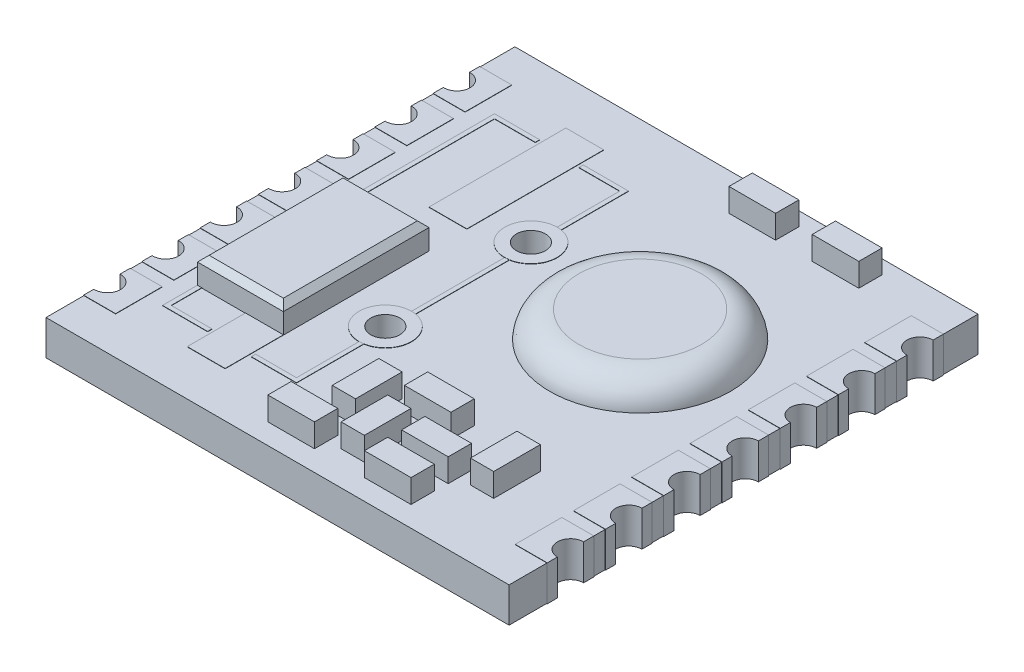
from build123d import *

# Parameters (mm, degrees)
SKIZZE1_W                       = 15.9
SKIZZE1_H                       = 1.2
LINEAR_AUSTRAGEN1_DEPTH         = 16.1
SKIZZE4_W                       = 1.6
SKIZZE4_H                       = 1.2
LINEAR_AUSTRAGEN2_DEPTH         = 0.01
SKIZZE3_W                       = 1.6
SKIZZE3_H                       = 1.2
LINEAR_AUSTRAGEN3_DEPTH         = 0.01
SKIZZE5_W                       = 1.1
SKIZZE5_H                       = 1.6
LINEAR_AUSTRAGEN4_DEPTH         = 0.01
SKIZZE6_W                       = 1.1
SKIZZE6_H                       = 1.6
LINEAR_AUSTRAGEN5_DEPTH         = 0.01
SKIZZE7_R                       = 0.45
SCHNITT_LINEAR_AUSTRAGEN2_DEPTH = 2
SKIZZE8_R                       = 3.1
LINEAR_AUSTRAGEN6_DEPTH         = 0.9
VERRUNDUNG1_R                   = 1
LINEAR_AUSTRAGEN7_DEPTH         = 0.01
SKIZZE10_R                      = 0.9
LINEAR_AUSTRAGEN9_DEPTH         = 0.011
SKIZZE11_R                      = 0.5
SCHNITT_LINEAR_AUSTRAGEN3_DEPTH = 2
SKIZZE12_W                      = 1.3
SKIZZE12_H                      = 4.7
LINEAR_AUSTRAGEN10_DEPTH        = 0.01
SKIZZE13_W                      = 2.95
SKIZZE13_H                      = 5
LINEAR_AUSTRAGEN11_DEPTH        = 0.9
FASE1_SIZE                      = 0.2
SKIZZE14_W                      = 1.6
SKIZZE14_H                      = 0.8
SKIZZE14_W_2                    = 0.8
SKIZZE14_H_2                    = 1.6
LINEAR_AUSTRAGEN12_DEPTH        = 0.8


with BuildPart() as part:
    # Skizze1 → Linear austragen1 (new body)
    with BuildSketch(Plane.XY):
        with Locations((7.95, 0.6)):
            Rectangle(SKIZZE1_W, SKIZZE1_H)
    extrude(amount=LINEAR_AUSTRAGEN1_DEPTH)

    # Skizze4 → Linear austragen2 (add)
    with BuildSketch(Plane.ZY):
        with Locations((14, 0.6)):
            Rectangle(SKIZZE4_W, SKIZZE4_H)
        with Locations((12, 0.6)):
            Rectangle(SKIZZE4_W, SKIZZE4_H)
        with Locations((10, 0.6)):
            Rectangle(SKIZZE4_W, SKIZZE4_H)
        with Locations((8, 0.6)):
            Rectangle(SKIZZE4_W, SKIZZE4_H)
        with Locations((6, 0.6)):
            Rectangle(SKIZZE4_W, SKIZZE4_H)
        with Locations((4, 0.6)):
            Rectangle(SKIZZE4_W, SKIZZE4_H)
        with Locations((2, 0.6)):
            Rectangle(SKIZZE4_W, SKIZZE4_H)
    extrude(amount=LINEAR_AUSTRAGEN2_DEPTH)

    # Skizze3 → Linear austragen3 (add)
    with BuildSketch(Plane(origin=(15.9, 0, 0), x_dir=(0, 0, -1), z_dir=(1, 0, 0))):
        with Locations((-14, 0.6)):
            Rectangle(SKIZZE3_W, SKIZZE3_H)
        with Locations((-12, 0.6)):
            Rectangle(SKIZZE3_W, SKIZZE3_H)
        with Locations((-10, 0.6)):
            Rectangle(SKIZZE3_W, SKIZZE3_H)
        with Locations((-8, 0.6)):
            Rectangle(SKIZZE3_W, SKIZZE3_H)
        with Locations((-6, 0.6)):
            Rectangle(SKIZZE3_W, SKIZZE3_H)
        with Locations((-4, 0.6)):
            Rectangle(SKIZZE3_W, SKIZZE3_H)
        with Locations((-2, 0.6)):
            Rectangle(SKIZZE3_W, SKIZZE3_H)
    extrude(amount=LINEAR_AUSTRAGEN3_DEPTH)

    # Skizze5 → Linear austragen4 (add)
    with BuildSketch(Plane(origin=(0, 1.2, 0), x_dir=(-1, 0, 0), z_dir=(0, 1, 0))):
        with Locations((-15.36, 2)):
            Rectangle(SKIZZE5_W, SKIZZE5_H)
        with Locations((-15.36, 4)):
            Rectangle(SKIZZE5_W, SKIZZE5_H)
        with Locations((-15.36, 8)):
            Rectangle(SKIZZE5_W, SKIZZE5_H)
        with Locations((-15.36, 10)):
            Rectangle(SKIZZE5_W, SKIZZE5_H)
        with Locations((-15.36, 12)):
            Rectangle(SKIZZE5_W, SKIZZE5_H)
        with Locations((-15.36, 14)):
            Rectangle(SKIZZE5_W, SKIZZE5_H)
        with Locations((-15.36, 6)):
            Rectangle(SKIZZE5_W, SKIZZE5_H)
        with Locations((-0.54, 2)):
            Rectangle(SKIZZE5_W, SKIZZE5_H)
        with Locations((-0.54, 4)):
            Rectangle(SKIZZE5_W, SKIZZE5_H)
        with Locations((-0.54, 6)):
            Rectangle(SKIZZE5_W, SKIZZE5_H)
        with Locations((-0.54, 8)):
            Rectangle(SKIZZE5_W, SKIZZE5_H)
        with Locations((-0.54, 10)):
            Rectangle(SKIZZE5_W, SKIZZE5_H)
        with Locations((-0.54, 12)):
            Rectangle(SKIZZE5_W, SKIZZE5_H)
        with Locations((-0.54, 14)):
            Rectangle(SKIZZE5_W, SKIZZE5_H)
    extrude(amount=LINEAR_AUSTRAGEN4_DEPTH)

    # Skizze6 → Linear austragen5 (add)
    with BuildSketch(Plane.XZ):
        with Locations((15.36, 14)):
            Rectangle(SKIZZE6_W, SKIZZE6_H)
        with Locations((15.36, 12)):
            Rectangle(SKIZZE6_W, SKIZZE6_H)
        with Locations((15.36, 10)):
            Rectangle(SKIZZE6_W, SKIZZE6_H)
        with Locations((15.36, 8)):
            Rectangle(SKIZZE6_W, SKIZZE6_H)
        with Locations((15.36, 6)):
            Rectangle(SKIZZE6_W, SKIZZE6_H)
        with Locations((15.36, 4)):
            Rectangle(SKIZZE6_W, SKIZZE6_H)
        with Locations((15.36, 2)):
            Rectangle(SKIZZE6_W, SKIZZE6_H)
        with Locations((0.54, 14)):
            Rectangle(SKIZZE6_W, SKIZZE6_H)
        with Locations((0.54, 12)):
            Rectangle(SKIZZE6_W, SKIZZE6_H)
        with Locations((0.54, 10)):
            Rectangle(SKIZZE6_W, SKIZZE6_H)
        with Locations((0.54, 8)):
            Rectangle(SKIZZE6_W, SKIZZE6_H)
        with Locations((0.54, 6)):
            Rectangle(SKIZZE6_W, SKIZZE6_H)
        with Locations((0.54, 4)):
            Rectangle(SKIZZE6_W, SKIZZE6_H)
        with Locations((0.54, 2)):
            Rectangle(SKIZZE6_W, SKIZZE6_H)
    extrude(amount=LINEAR_AUSTRAGEN5_DEPTH)

    # Skizze7 → Schnitt-Linear austragen2 (cut)
    with BuildSketch(Plane(origin=(0, 1.21, 0), x_dir=(-1, 0, 0), z_dir=(0, 1, 0))):
        with Locations((-15.91, 2)):
            Circle(SKIZZE7_R)
        with Locations((-0.01, 2)):
            Circle(SKIZZE7_R)
        with Locations((-15.91, 4)):
            Circle(SKIZZE7_R)
        with Locations((-0.01, 4)):
            Circle(SKIZZE7_R)
        with Locations((-15.91, 6)):
            Circle(SKIZZE7_R)
        with Locations((-0.01, 6)):
            Circle(SKIZZE7_R)
        with Locations((-15.91, 8)):
            Circle(SKIZZE7_R)
        with Locations((-0.01, 8)):
            Circle(SKIZZE7_R)
        with Locations((-15.91, 10)):
            Circle(SKIZZE7_R)
        with Locations((-0.01, 10)):
            Circle(SKIZZE7_R)
        with Locations((-15.91, 12)):
            Circle(SKIZZE7_R)
        with Locations((-0.01, 12)):
            Circle(SKIZZE7_R)
        with Locations((-15.91, 14)):
            Circle(SKIZZE7_R)
        with Locations((-0.01, 14)):
            Circle(SKIZZE7_R)
    extrude(amount=-SCHNITT_LINEAR_AUSTRAGEN2_DEPTH, mode=Mode.SUBTRACT)

    # Skizze8 → Linear austragen6 (add)
    with BuildSketch(Plane(origin=(0, 1.2, 0), x_dir=(-1, 0, 0), z_dir=(0, 1, 0))):
        with Locations(Location((-10.85, 6.55, 0), (0, 0, 180))):
            Circle(SKIZZE8_R)
    extrude(amount=LINEAR_AUSTRAGEN6_DEPTH)

    # Verrundung1
    # the kernel refuses this fillet: 1 mm, written as the material it takes off along each edge
    with BuildSketch(Plane(origin=(10.85, 2.1, 6.55), x_dir=(1, 0, 0), z_dir=(0, 0, 1))) as verrundung1_piece_1:
        with BuildLine():
            CenterArc((2.105012563, -1), VERRUNDUNG1_R, 5.739170477, 84.260829523)
            Line((2.105012563, 0), (2.105012563, 0.02))
            Line((2.105012563, 0.02), (3.1, 0.02))
            Line((3.1, 0.02), (3.12, 0))
            ThreePointArc((3.12, 0), (3.12, -0.45), (3.119899749, -0.898))
            Line((3.119899749, -0.898), (3.1, -0.9))
        make_face()
    revolve(axis=Axis((10.85, 2.1, 6.55), (0, 1, 0)), mode=Mode.SUBTRACT)

    # Skizze9 → Linear austragen7 (add)
    with BuildSketch(Plane(origin=(0, 1.2, 0), x_dir=(-1, 0, 0), z_dir=(0, 1, 0))):
        Polygon((-1.65, 2.35), (-3.2, 2.35), (-3.2, 2.5), (-1.8, 2.5), (-1.8, 13.6), (-3.2, 13.6), (-3.2, 13.75), (-1.65, 13.75), align=None)
        Polygon((-6.25, 2.35), (-6.25, 13.75), (-4.7, 13.75), (-4.7, 13.6), (-6.1, 13.6), (-6.1, 2.5), (-4.7, 2.5), (-4.7, 2.35), align=None)
    extrude(amount=LINEAR_AUSTRAGEN7_DEPTH)

    # Skizze10 → Linear austragen9 (add)
    with BuildSketch(Plane(origin=(0, 1.2, 0), x_dir=(-1, 0, 0), z_dir=(0, 1, 0))):
        with Locations(Location((-6.1, 5.55, 0), (0, 0, 99.594068227))):
            Circle(SKIZZE10_R)
        with Locations(Location((-6.1, 10.55, 0), (0, 0, 99.594068227))):
            Circle(SKIZZE10_R)
    extrude(amount=LINEAR_AUSTRAGEN9_DEPTH)

    # Skizze11 → Schnitt-Linear austragen3 (cut)
    with BuildSketch(Plane(origin=(0, 1.211, 0), x_dir=(-1, 0, 0), z_dir=(0, 1, 0))):
        with Locations((-6.1, 10.55)):
            Circle(SKIZZE11_R)
        with Locations((-6.1, 5.55)):
            Circle(SKIZZE11_R)
    extrude(amount=-SCHNITT_LINEAR_AUSTRAGEN3_DEPTH, mode=Mode.SUBTRACT)

    # Skizze12 → Linear austragen10 (add)
    with BuildSketch(Plane(origin=(0, 1.2, 0), x_dir=(-1, 0, 0), z_dir=(0, 1, 0))):
        with Locations((-3.95, 3.9)):
            Rectangle(SKIZZE12_W, SKIZZE12_H)
        with Locations((-3.95, 12.2)):
            Rectangle(SKIZZE12_W, SKIZZE12_H)
    extrude(amount=LINEAR_AUSTRAGEN10_DEPTH)

    # Skizze13 → Linear austragen11 (add)
    with BuildSketch(Plane(origin=(0, 1.2, 0), x_dir=(-1, 0, 0), z_dir=(0, 1, 0))):
        with Locations((-3.125, 10.05)):
            Rectangle(SKIZZE13_W, SKIZZE13_H)
    extrude(amount=LINEAR_AUSTRAGEN11_DEPTH)

    # Fase1
    fase1_edges = [part.edges().sort_by_distance(p)[0] for p in [
        (1.65, 2.1, 10.05),
        (3.125, 2.1, 12.55),
        (4.6, 2.1, 10.05),
        (3.125, 2.1, 7.55),
    ]]
    chamfer(fase1_edges, length=FASE1_SIZE)

    # Skizze14 → Linear austragen12 (add)
    with BuildSketch(Plane(origin=(0, 1.2, 0), x_dir=(-1, 0, 0), z_dir=(0, 1, 0))):
        with Locations((-12.284109203, 0.877228288)):
            Rectangle(SKIZZE14_W, SKIZZE14_H)
        with Locations((-9.426598021, 0.877228288)):
            Rectangle(SKIZZE14_W, SKIZZE14_H)
        with Locations((-11.026741258, 14.994041121)):
            Rectangle(SKIZZE14_W, SKIZZE14_H)
        with Locations((-11.045792288, 13.736673176)):
            Rectangle(SKIZZE14_W, SKIZZE14_H)
        with Locations((-9.769373314, 12.364999055)):
            Rectangle(SKIZZE14_W, SKIZZE14_H)
        with Locations((-7.711862132, 14.994041121)):
            Rectangle(SKIZZE14_W, SKIZZE14_H)
        with Locations((-9.369230076, 14.136673176)):
            Rectangle(SKIZZE14_W_2, SKIZZE14_H_2)
        with Locations((-8.13098478, 13.203172733)):
            Rectangle(SKIZZE14_W_2, SKIZZE14_H_2)
        with Locations((-12.665129792, 12.993611408)):
            Rectangle(SKIZZE14_W_2, SKIZZE14_H_2)
    extrude(amount=LINEAR_AUSTRAGEN12_DEPTH)


solid = part.part
